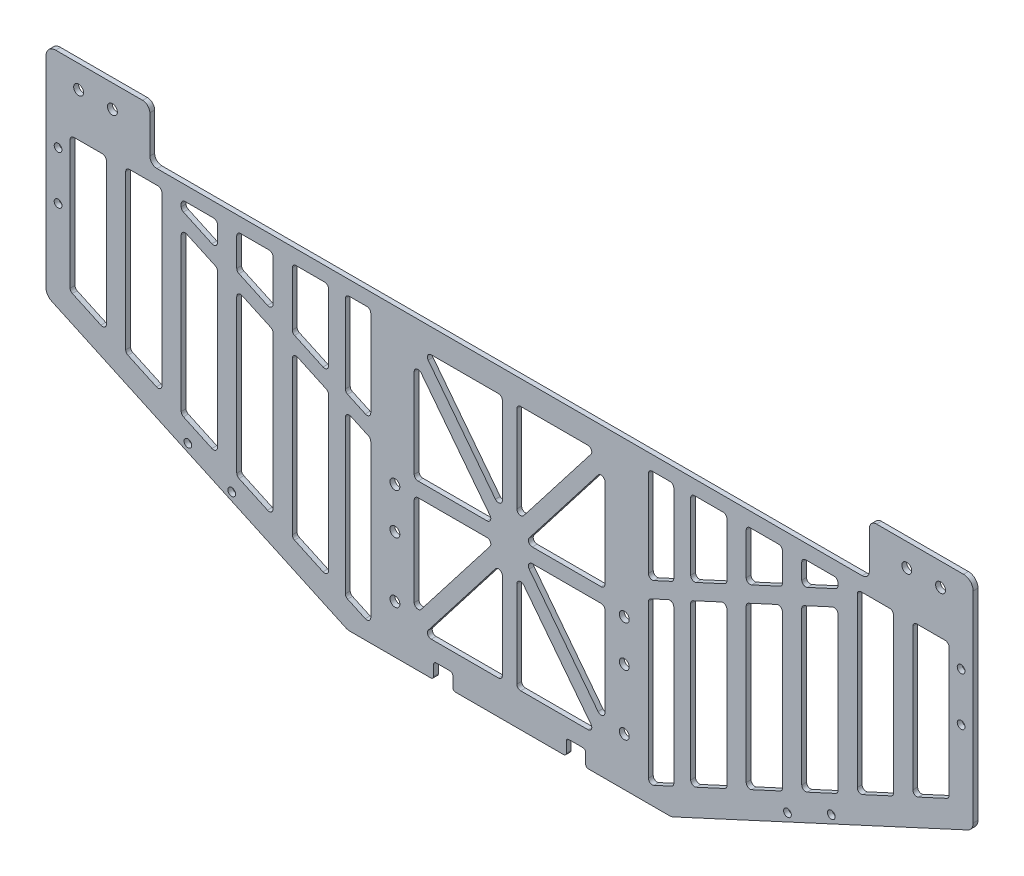
from build123d import *

# Parameters (mm, degrees)
SKETCH_1_W           = 384
SKETCH_1_H           = 130
EXTRUDE_1_DEPTH      = 2
SKETCH_2_W           = 18
SKETCH_2_H           = 8
CUT_EXTRUDE_1_DEPTH  = 3
SKETCH_3_W           = 254
SKETCH_3_H           = 4
CUT_EXTRUDE_2_DEPTH  = 3
CUT_EXTRUDE_3_DEPTH  = 10
SKETCH_5_R           = 1.6
CUT_EXTRUDE_4_DEPTH  = 10
SKETCH_6_R           = 1.6
CUT_EXTRUDE_5_DEPTH  = 10
SKETCH_7_R           = 2.05
CUT_EXTRUDE_6_DEPTH  = 10
CUT_EXTRUDE_7_DEPTH  = 10
CUT_EXTRUDE_8_DEPTH  = 10
EXTRUDE_2_DEPTH      = 2
FILLET_1_R           = 1.6
SKETCH_11_W          = 47
SKETCH_11_H          = 17.5
EXTRUDE_3_DEPTH      = 2
FILLET_2_R           = 4
SKETCH_13_R          = 2.05
CUT_EXTRUDE_10_DEPTH = 10
SKETCH_14_W          = 8
SKETCH_14_H          = 13
CUT_EXTRUDE_11_DEPTH = 10
FILLET_4_R           = 1.1
SKETCH_15_W          = 8
SKETCH_15_H          = 21.5
CUT_EXTRUDE_12_DEPTH = 10
FILLET_5_R           = 3


with BuildPart() as part:
    # 草图1 → 凸台-拉伸1 (new body)
    with BuildSketch(Plane.XY):
        Rectangle(SKETCH_1_W, SKETCH_1_H)
    extrude(amount=EXTRUDE_1_DEPTH)

    # 草图2 → 切除-拉伸1 (cut)
    with BuildSketch(Plane.XY.offset(2)):
        with Locations((-136, 65)):
            Rectangle(SKETCH_2_W, SKETCH_2_H)
    cut_extrude_1 = extrude(amount=-CUT_EXTRUDE_1_DEPTH, mode=Mode.SUBTRACT)

    # 镜向1: 切除-拉伸1 across plane
    add(cut_extrude_1.mirror(Plane(origin=(0, 0, 0), x_dir=(0, 0, 1), z_dir=(1, 0, 0))), mode=Mode.SUBTRACT)

    # 草图3 → 切除-拉伸2 (cut)
    with BuildSketch(Plane.XY.offset(2)):
        with Locations((0, 63)):
            Rectangle(SKETCH_3_W, SKETCH_3_H)
    extrude(amount=-CUT_EXTRUDE_2_DEPTH, mode=Mode.SUBTRACT)

    # 草图4 → 切除-拉伸3 (cut)
    with BuildSketch(Plane.XY.offset(2)):
        Polygon((67, -65), (192, -7.307692308), (192, -65), align=None)
    cut_extrude_3 = extrude(amount=-CUT_EXTRUDE_3_DEPTH, mode=Mode.SUBTRACT)

    # 镜向2: 切除-拉伸3 across plane
    add(cut_extrude_3.mirror(Plane(origin=(0, 0, 0), x_dir=(0, 0, 1), z_dir=(1, 0, 0))), mode=Mode.SUBTRACT)

    # 草图5 → 切除-拉伸4 (cut)
    with BuildSketch(Plane.XY.offset(2)):
        with Locations((187, 28)):
            Circle(SKETCH_5_R)
        with Locations((187, 48)):
            Circle(SKETCH_5_R)
    cut_extrude_4 = extrude(amount=-CUT_EXTRUDE_4_DEPTH, mode=Mode.SUBTRACT)

    # 镜向3: 切除-拉伸4 across plane
    add(cut_extrude_4.mirror(Plane(origin=(0, 0, 0), x_dir=(0, 0, 1), z_dir=(1, 0, 0))), mode=Mode.SUBTRACT)

    # 草图6 → 切除-拉伸5 (cut)
    with BuildSketch(Plane(origin=(0, 0, 0), x_dir=(-1, 0, 0), z_dir=(0, 0, -1))):
        with Locations((-133.23981454, -31.123665352)):
            Circle(SKETCH_6_R)
        with Locations((-115.08062685, -39.504828901)):
            Circle(SKETCH_6_R)
    cut_extrude_5 = extrude(amount=-CUT_EXTRUDE_5_DEPTH, mode=Mode.SUBTRACT)

    # 镜向4: 切除-拉伸5 across plane
    add(cut_extrude_5.mirror(Plane(origin=(0, 0, 0), x_dir=(0, 0, 1), z_dir=(1, 0, 0))), mode=Mode.SUBTRACT)

    # 草图7 → 切除-拉伸6 (cut)
    with BuildSketch(Plane.XY.offset(2)):
        with Locations((-47.5, -45)):
            Circle(SKETCH_7_R)
        with Locations((-47.5, -20)):
            Circle(SKETCH_7_R)
        with Locations((-47.5, -3)):
            Circle(SKETCH_7_R)
    cut_extrude_6 = extrude(amount=-CUT_EXTRUDE_6_DEPTH, mode=Mode.SUBTRACT)

    # 镜向5: 切除-拉伸6 across plane
    add(cut_extrude_6.mirror(Plane(origin=(0, 0, 0), x_dir=(0, 0, 1), z_dir=(1, 0, 0))), mode=Mode.SUBTRACT)

    # 草图8 → 切除-拉伸7 (cut)
    with BuildSketch(Plane.XY.offset(2)):
        Polygon((-167, 55), (-182, 55), (-182, -0.909368413), (-167, -7.832445336), align=None)
        Polygon((-144, 55), (-159, 55), (-159, -11.524753028), (-144, -18.447829951), align=None)
        Polygon((-121, 55), (-136, 55), (-136, -22.140137644), (-121, -29.063214567), align=None)
        Polygon((-98, 55), (-113, 55), (-113, -32.755522259), (-98, -39.678599182), align=None)
        Polygon((-75, 55), (-90, 55), (-90, -43.370906874), (-75, -50.293983797), align=None)
        Polygon((-57.5, 55), (-68, 55), (-68, -53.524753028), (-57.5, -58.370906874), align=None)
    cut_extrude_7 = extrude(amount=-CUT_EXTRUDE_7_DEPTH, mode=Mode.SUBTRACT)

    # 镜向6: 切除-拉伸7 across plane
    add(cut_extrude_7.mirror(Plane(origin=(0, 0, 0), x_dir=(0, 0, 1), z_dir=(1, 0, 0))), mode=Mode.SUBTRACT)

    # 草图9 → 切除-拉伸8 (cut)
    with BuildSketch(Plane.XY.offset(2)):
        Polygon((-35.705426384, -51), (-3, -51), (-3, -8.772740618), align=None)
        Polygon((3, -8.772740618), (3, -51), (35.705426384, -51), align=None)
        Polygon((6.118103028, -3), (39.5, -46.100677103), (39.5, -3), align=None)
        Polygon((6.118103028, 3), (39.5, 3), (39.5, 46.100677103), align=None)
        Polygon((3, 51), (3, 8.772740618), (35.705426384, 51), align=None)
        Polygon((-35.705426384, 51), (-3, 8.772740618), (-3, 51), align=None)
        Polygon((-39.5, 46.100677103), (-39.5, 3), (-6.118103028, 3), align=None)
        Polygon((-39.5, -3), (-39.5, -46.100677103), (-6.118103028, -3), align=None)
    extrude(amount=-CUT_EXTRUDE_8_DEPTH, mode=Mode.SUBTRACT)

    # 草图10 → 凸台-拉伸2 (add)
    with BuildSketch(Plane.XY.offset(2)):
        Polygon((-144, 55), (-57.5, 15.076923077), (-57.5, 8.468697971), (-144, 48.391774894), align=None)
    extrude_2 = extrude(amount=-EXTRUDE_2_DEPTH)

    # 镜向7: 凸台-拉伸2 across plane
    add(extrude_2.mirror(Plane(origin=(0, 0, 0), x_dir=(0, 0, 1), z_dir=(1, 0, 0))))

    # 圆角1
    fillet_1_edges = [part.edges().sort_by_distance(p)[0] for p in [
        (-167, 55, 1),
        (-167, -7.832445336, 1),
        (-182, -0.909368413, 1),
        (-182, 55, 1),
        (-144, 55, 1),
        (-144, -18.447829951, 1),
        (-159, -11.524753028, 1),
        (-159, 55, 1),
        (-121, 55, 1),
        (-121, -29.063214567, 1),
        (-136, -22.140137644, 1),
        (-136, 55, 1),
        (-98, 55, 1),
        (-98, -39.678599182, 1),
        (-113, -32.755522259, 1),
        (-113, 55, 1),
        (-75, 55, 1),
        (-75, -50.293983797, 1),
        (-90, -43.370906874, 1),
        (-90, 55, 1),
        (-68, 55, 1),
        (-57.5, 55, 1),
        (-57.5, -58.370906874, 1),
        (-68, -53.524753028, 1),
        (167, -7.832445336, 1),
        (167, 55, 1),
        (182, 55, 1),
        (182, -0.909368413, 1),
        (144, -18.447829951, 1),
        (144, 55, 1),
        (159, 55, 1),
        (159, -11.524753028, 1),
        (121, -29.063214567, 1),
        (121, 55, 1),
        (136, 55, 1),
        (136, -22.140137644, 1),
        (98, -39.678599182, 1),
        (98, 55, 1),
        (113, 55, 1),
        (113, -32.755522259, 1),
        (75, -50.293983797, 1),
        (75, 55, 1),
        (90, 55, 1),
        (90, -43.370906874, 1),
        (57.5, 55, 1),
        (68, 55, 1),
        (68, -53.524753028, 1),
        (57.5, -58.370906874, 1),
        (-39.5, -3, 1),
        (-6.118103028, -3, 1),
        (-39.5, -46.100677103, 1),
        (-3, 51, 1),
        (-3, 8.772740618, 1),
        (-35.705426384, 51, 1),
        (-39.5, 3, 1),
        (-39.5, 46.100677103, 1),
        (-6.118103028, 3, 1),
        (6.118103028, 3, 1),
        (39.5, 46.100677103, 1),
        (39.5, 3, 1),
        (3, 51, 1),
        (35.705426384, 51, 1),
        (3, 8.772740618, 1),
        (3, -8.772740618, 1),
        (35.705426384, -51, 1),
        (3, -51, 1),
        (6.118103028, -3, 1),
        (39.5, -3, 1),
        (39.5, -46.100677103, 1),
        (-3, -8.772740618, 1),
        (-3, -51, 1),
        (-35.705426384, -51, 1),
        (-57.5, 8.468697971, 1),
        (-68, 13.314851817, 1),
        (-75, 16.545621048, 1),
        (-90, 23.468697971, 1),
        (-98, 27.161005663, 1),
        (-113, 34.084082586, 1),
        (-121, 37.776390278, 1),
        (-68, 19.923076923, 1),
        (-75, 23.153846154, 1),
        (-90, 30.076923077, 1),
        (-98, 33.769230769, 1),
        (-113, 40.692307692, 1),
        (-121, 44.384615385, 1),
        (-136, 44.699467202, 1),
        (-57.5, 15.076923077, 1),
        (-136, 51.307692308, 1),
        (68, 13.314851817, 1),
        (75, 16.545621048, 1),
        (90, 23.468697971, 1),
        (98, 27.161005663, 1),
        (113, 34.084082586, 1),
        (121, 37.776390278, 1),
        (136, 44.699467202, 1),
        (68, 19.923076923, 1),
        (75, 23.153846154, 1),
        (90, 30.076923077, 1),
        (98, 33.769230769, 1),
        (113, 40.692307692, 1),
        (121, 44.384615385, 1),
        (136, 51.307692308, 1),
        (57.5, 8.468697971, 1),
        (57.5, 15.076923077, 1),
    ]]
    fillet(fillet_1_edges, radius=FILLET_1_R)

    # 草图11 → 凸台-拉伸3 (add)
    with BuildSketch(Plane(origin=(0, 0, 0), x_dir=(-1, 0, 0), z_dir=(0, 0, -1))):
        with Locations((-168.5, 73.75)):
            Rectangle(SKETCH_11_W, SKETCH_11_H)
    extrude_3 = extrude(amount=-EXTRUDE_3_DEPTH)

    # 镜向8: 凸台-拉伸3 across plane
    add(extrude_3.mirror(Plane(origin=(0, 0, 0), x_dir=(0, 0, 1), z_dir=(1, 0, 0))))

    # 圆角2
    fillet_2_edges = [part.edges().sort_by_distance(p)[0] for p in [
        (192, 82.5, 1),
        (145, 82.5, 1),
        (-145, 82.5, 1),
        (-192, 82.5, 1),
        (-145, 61, 1),
        (145, 61, 1),
        (67, -65, 1),
        (192, -7.307692308, 1),
        (-67, -65, 1),
        (-192, -7.307692308, 1),
    ]]
    fillet(fillet_2_edges, radius=FILLET_2_R)

    # 草图13 → 切除-拉伸10 (cut)
    with BuildSketch(Plane(origin=(0, 0, 0), x_dir=(-1, 0, 0), z_dir=(0, 0, -1))):
        with Locations((178.5, 73)):
            Circle(SKETCH_13_R)
        with Locations((164.5, 73)):
            Circle(SKETCH_13_R)
    cut_extrude_10 = extrude(amount=-CUT_EXTRUDE_10_DEPTH, mode=Mode.SUBTRACT)

    # 镜向10: 切除-拉伸10 across plane
    add(cut_extrude_10.mirror(Plane(origin=(0, 0, 0), x_dir=(0, 0, 1), z_dir=(1, 0, 0))), mode=Mode.SUBTRACT)

    # 草图14 → 切除-拉伸11 (cut)
    with BuildSketch(Plane(origin=(0, 0, 0), x_dir=(-1, 0, 0), z_dir=(0, 0, -1))):
        with Locations((27.5, -65)):
            Rectangle(SKETCH_14_W, SKETCH_14_H)
        with Locations((-27.5, -65)):
            Rectangle(SKETCH_14_W, SKETCH_14_H)
    extrude(amount=-CUT_EXTRUDE_11_DEPTH, mode=Mode.SUBTRACT)

    # 圆角4
    fillet_4_edges = [part.edges().sort_by_distance(p)[0] for p in [
        (-23.5, -65, 1),
        (-31.5, -65, 1),
        (31.5, -65, 1),
        (23.5, -65, 1),
        (31.5, -58.5, 1),
        (23.5, -58.5, 1),
        (-23.5, -58.5, 1),
        (-31.5, -58.5, 1),
    ]]
    fillet(fillet_4_edges, radius=FILLET_4_R)

    # 草图15 → 切除-拉伸12 (cut)
    with BuildSketch(Plane.XY.offset(2)):
        with Locations((-145, 71.75)):
            Rectangle(SKETCH_15_W, SKETCH_15_H)
        with Locations((145, 71.75)):
            Rectangle(SKETCH_15_W, SKETCH_15_H)
    extrude(amount=-CUT_EXTRUDE_12_DEPTH, mode=Mode.SUBTRACT)

    # 圆角5
    fillet_5_edges = [part.edges().sort_by_distance(p)[0] for p in [
        (-149, 82.5, 1),
        (149, 82.5, 1),
        (-149, 61, 1),
        (149, 61, 1),
    ]]
    fillet(fillet_5_edges, radius=FILLET_5_R)


solid = part.part
